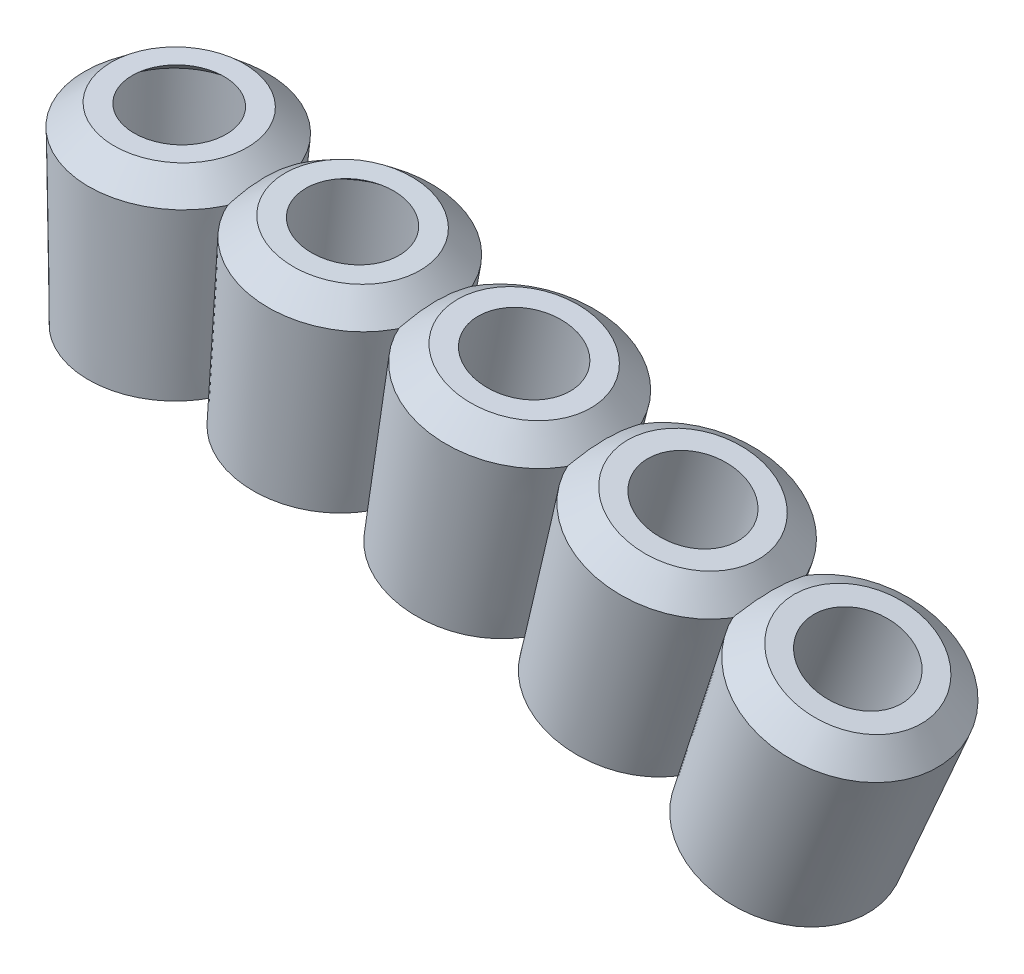
from build123d import *

# Parameters (mm, degrees)
CIRPATTERN2_COUNT = 5
CIRPATTERN2_ANGLE = 18.4


# Read off the part's stored shape, not the designer's step: Revolve2
with BuildPart() as part:
    # Revolve2 outline → Revolve2 (revolve)
    with BuildSketch(Plane(origin=(0, 0, 6.92820323), x_dir=(0.9990482215818577, -0.04361938736533579, 0), z_dir=(0, 0, 1))):
        Polygon((2.03, 60.953230193), (2.03, 55.946700409), (2.442685692, 55.946700409), (2.660074407, 60.92572055), (1.932693209, 61.56), (1.334166406, 61.56), align=None)
    revolve(axis=Axis((0, 0, 6.92820323), (0.04361938736533579, 0.9990482215818577, 0)))


with BuildPart() as cirpattern2_1:
    # CirPattern2: pattern copy
    add(part.part.rotate(Axis((0, 0, 0), (0, 0, -1)), 1 * CIRPATTERN2_ANGLE / (CIRPATTERN2_COUNT - 1)))


with BuildPart() as cirpattern2_2:
    # CirPattern2: pattern copy
    add(part.part.rotate(Axis((0, 0, 0), (0, 0, -1)), 2 * CIRPATTERN2_ANGLE / (CIRPATTERN2_COUNT - 1)))


with BuildPart() as cirpattern2_3:
    # CirPattern2: pattern copy
    add(part.part.rotate(Axis((0, 0, 0), (0, 0, -1)), 3 * CIRPATTERN2_ANGLE / (CIRPATTERN2_COUNT - 1)))


with BuildPart() as cirpattern2_4:
    # CirPattern2: pattern copy
    add(part.part.rotate(Axis((0, 0, 0), (0, 0, -1)), 4 * CIRPATTERN2_ANGLE / (CIRPATTERN2_COUNT - 1)))


solid = Compound([part.part, cirpattern2_1.part, cirpattern2_2.part, cirpattern2_3.part, cirpattern2_4.part])
